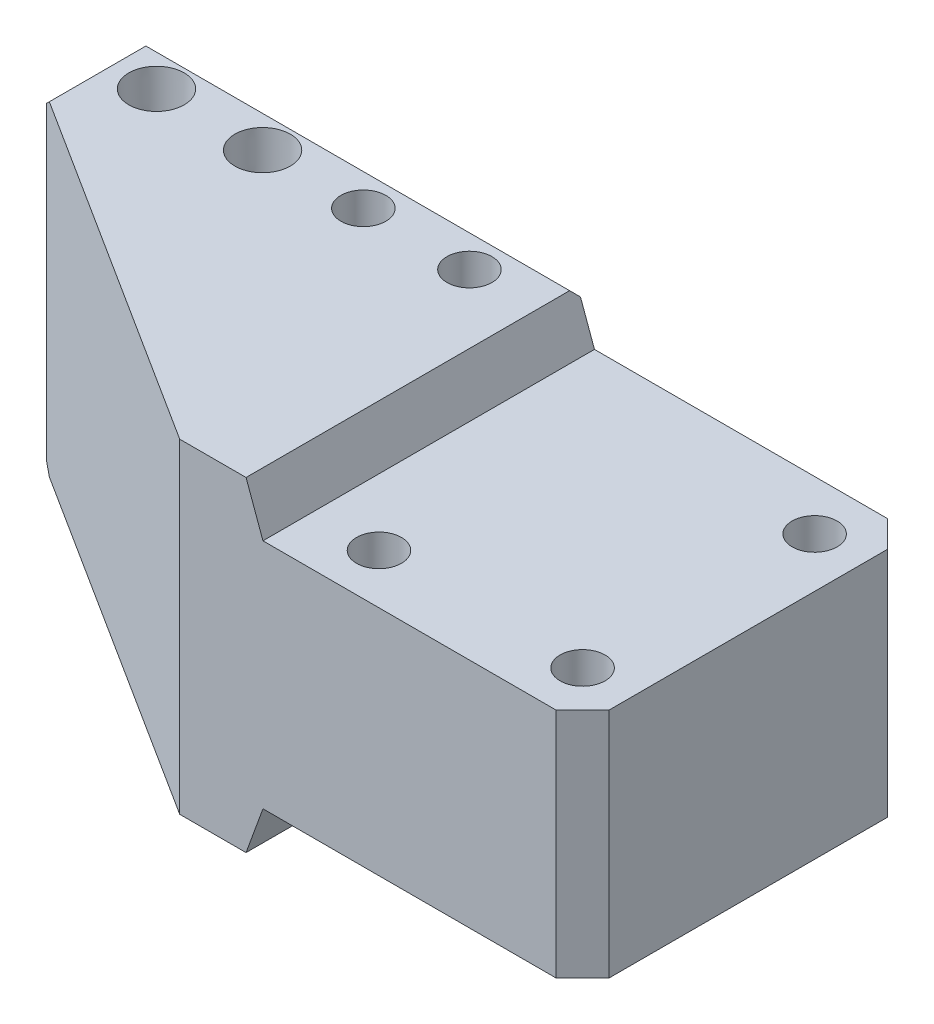
from build123d import *

# Parameters (mm, degrees)
SKETCH1_W                       = 42.960806382
SKETCH1_H                       = 31.115
BOSS_EXTRUDE1_DEPTH             = 12.7
SKETCH2_W                       = 42.960806382
SKETCH2_H                       = 22.225
BOSS_EXTRUDE2_DEPTH             = 19.05
BOSS_EXTRUDE3_DEPTH             = 22.225
DRAFT1_START                    = 15
DRAFT1_OUTLINE_W                = 22.225
DRAFT1_OUTLINE_H                = 19.270002336
DRAFT1_DEPTH                    = 6.752762537
BOSS_EXTRUDE4_REACH             = 69.308
SKETCH6_W                       = 42.960806382
SKETCH6_H                       = 4.445
DRAFT3_ANGLE                    = 20
DRAFT4_ANGLE                    = 20
BOSS_EXTRUDE5_DEPTH             = 22.225
F_6_CLEARANCE_HOLE1_D           = 4.3053
F_6_CLEARANCE_HOLE2_D           = 4.3053
F_6_CLEARANCE_HOLE2_ON_FACE_2_D = 4.3053
HOLE1_AT_2_COUNT                = 2
HOLE1_AT_2_PITCH                = 10.16
HOLE2_AT_2_COUNT                = 2
HOLE2_AT_2_PITCH                = 10.16
CUT_EXTRUDE1_DEPTH              = 70.758470007
CHAMFER1_SIZE                   = 2.54
CHAMFER2_SIZE                   = 0.762


with BuildPart() as part:
    # Sketch1 → Boss-Extrude1 (new body)
    with BuildSketch(Plane.XY):
        with Locations((1.668403191, -9.5885)):
            Rectangle(SKETCH1_W, SKETCH1_H)
    extrude(amount=BOSS_EXTRUDE1_DEPTH)

    # Sketch2 → Boss-Extrude2 (add)
    with BuildSketch(Plane.XY.offset(12.7)):
        with Locations((1.668403191, -9.5885)):
            Rectangle(SKETCH2_W, SKETCH2_H)
    extrude(amount=BOSS_EXTRUDE2_DEPTH)

    # Sketch3 → Boss-Extrude3 (add)
    with BuildSketch(Plane.XZ.offset(20.701)):
        Polygon((23.148806382, 31.75), (53.759077492, 31.75), (53.759077492, 0), (44.234077492, 0), (44.234077492, 18.107878998), (23.148806382, 18.107878998), align=None)
    extrude(amount=-BOSS_EXTRUDE3_DEPTH)

    # Draft1: read off the stored shape, not the designer's step
    # Draft1 outline → Draft1 (add)
    with BuildSketch(Plane(origin=(0, 0, 0), x_dir=(0, 1, 0), z_dir=(0.9396926207859083, 0, -0.3420201433256691)).offset(DRAFT1_START)):
        with Locations((-9.5885, 17.552359245)):
            Rectangle(DRAFT1_OUTLINE_W, DRAFT1_OUTLINE_H)
    extrude(amount=DRAFT1_DEPTH)

    # Sketch6 → Boss-Extrude4 (add, up to next)
    with BuildSketch(Plane.XY.offset(31.75), mode=Mode.PRIVATE) as boss_extrude4_sk1:
        with Locations((1.668403191, 3.7465)):
            Rectangle(SKETCH6_W, SKETCH6_H)
    boss_extrude4_tool1 = extrude(boss_extrude4_sk1.sketch, amount=-BOSS_EXTRUDE4_REACH, mode=Mode.PRIVATE) - part.part
    # Sketch6 → Boss-Extrude4 (add, up to next)
    with BuildSketch(Plane.XY.offset(31.75), mode=Mode.PRIVATE) as boss_extrude4_sk2:
        with Locations((1.668403191, -22.9235)):
            Rectangle(SKETCH6_W, SKETCH6_H)
    boss_extrude4_tool2 = extrude(boss_extrude4_sk2.sketch, amount=-BOSS_EXTRUDE4_REACH, mode=Mode.PRIVATE) - part.part
    add(boss_extrude4_tool1.solids().sort_by_distance((1.668403, 3.7465, 31.75))[0])
    add(boss_extrude4_tool2.solids().sort_by_distance((1.668403, -22.9235, 31.75))[0])

    # Draft3
    draft3_faces = [part.faces().sort_by_distance(p)[0] for p in [
        (23.148806382, -22.9235, 15.875),
    ]]
    draft(draft3_faces, Plane(origin=(23.148806382, -20.701, 31.75), x_dir=(-1, 0, 0), z_dir=(0, -1, 0)), DRAFT3_ANGLE)

    # Draft4
    draft4_faces = [part.faces().sort_by_distance(p)[0] for p in [
        (23.148806382, 3.7465, 15.875),
    ]]
    draft(draft4_faces, Plane(origin=(23.148806382, 1.524, 31.75), x_dir=(1, 0, 0), z_dir=(0, 1, 0)), DRAFT4_ANGLE)

    # Sketch8 → Boss-Extrude5 (add)
    with BuildSketch(Plane.XZ.offset(20.701)):
        Polygon((29.739535343, 18.107878998), (23.148806382, 0), (44.234077492, 0), (44.234077492, 18.107878998), align=None)
    extrude(amount=-BOSS_EXTRUDE5_DEPTH)

    # #6 Clearance Hole1 (through all)
    with Locations(Plane(origin=(0, -20.701, 0), x_dir=(-1, 0, 0), z_dir=(0, -1, 0))):
        with Locations((-48.996577492, -26.9875), (-48.996577492, -4.7625), (-29.498806382, -26.9875)):
            Hole(F_6_CLEARANCE_HOLE1_D / 2)

    # #6 Clearance Hole2 (through all)
    with Locations(Plane(origin=(-14.986, -25.146, 3.81), x_dir=(-1, 0, 0), z_dir=(0, -1, 0))):
        with Locations((0, 0), (-10.16, 0)):
            Hole(F_6_CLEARANCE_HOLE2_D / 2)

    # #6 Clearance Hole2 on face 2 (through all)
    with Locations(Plane(origin=(14.986, 5.969, 3.81), x_dir=(0, 0, 1), z_dir=(0, 1, 0))):
        with Locations((0, 0), (0, -10.16)):
            Hole(F_6_CLEARANCE_HOLE2_ON_FACE_2_D / 2)

    # Sketch18 → Hole1 (revolve, cut)
    with BuildSketch(Plane(origin=(-4.826, 5.969, 3.81), x_dir=(0, 0, 1), z_dir=(1, 0, 0))):
        Polygon((0, 0), (0, 3.81), (2.5273, 3.81), (2.6543, 0), align=None)
    hole1 = revolve(axis=Axis((-4.826, -104.031, 3.81), (0, 1, 0)), mode=Mode.SUBTRACT)

    # Hole1 at 2: Hole1 ×2
    with Locations(*[(-i * HOLE1_AT_2_PITCH, 0, 0) for i in range(1, HOLE1_AT_2_COUNT)]):
        add(hole1, mode=Mode.SUBTRACT)

    # Sketch20 → Hole2 (revolve, cut)
    with BuildSketch(Plane(origin=(4.826, -25.146, 3.81), x_dir=(0, 0, -1), z_dir=(1, 0, 0))):
        Polygon((0, 0), (0, 3.81), (2.5273, 3.81), (2.6543, 0), align=None)
    hole2 = revolve(axis=Axis((4.826, 84.854, 3.81), (0, -1, 0)), mode=Mode.SUBTRACT)

    # Hole2 at 2: Hole2 ×2
    with Locations(*[(i * HOLE2_AT_2_PITCH, 0, 0) for i in range(1, HOLE2_AT_2_COUNT)]):
        add(hole2, mode=Mode.SUBTRACT)

    # Sketch21 → Cut-Extrude1 (cut, through all)
    with BuildSketch(Plane(origin=(0, 5.969, 0), x_dir=(1, 0, 0), z_dir=(0, 1, 0))):
        Polygon((-19.812, -9.525), (-19.812, -31.75), (15.180958691, -31.75), align=None)
    extrude(amount=-CUT_EXTRUDE1_DEPTH, mode=Mode.SUBTRACT)

    # Chamfer1
    chamfer1_edges = [part.edges().sort_by_distance(p)[0] for p in [
        (53.759077492, -9.5885, 31.75),
        (53.759077492, -9.5885, 0),
    ]]
    chamfer(chamfer1_edges, length=CHAMFER1_SIZE)

    # Chamfer2
    chamfer2_edges = [part.edges().sort_by_distance(p)[0] for p in [
        (-19.812, -25.146, 4.7625),
        (-19.812, 5.969, 4.7625),
        (0.859479345, -25.146, 0),
        (-19.812, -9.5885, 0),
        (0.859479345, 5.969, 0),
    ]]
    chamfer(chamfer2_edges, length=CHAMFER2_SIZE)


solid = part.part
